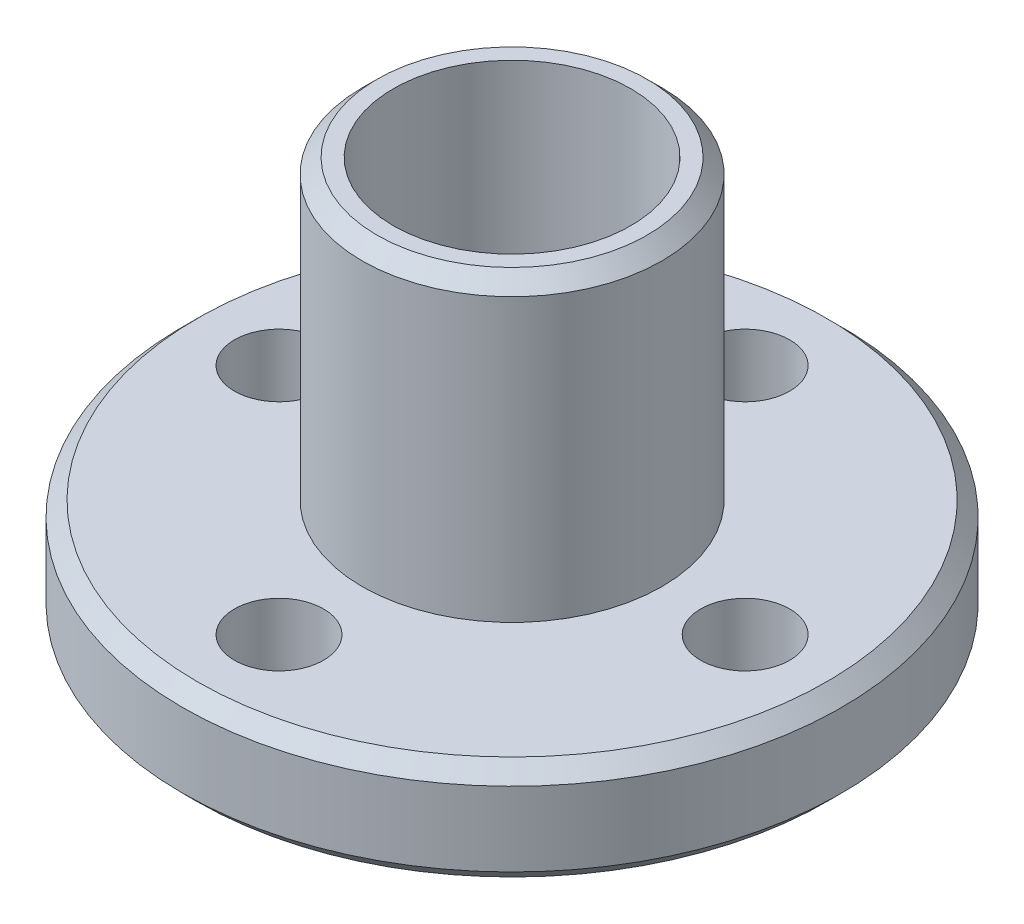
from build123d import *

# Parameters (mm, degrees)
SKETCH1_R           = 11.1
SKETCH1_R_2         = 4
BOSS_EXTRUDE1_DEPTH = 3.5
SKETCH2_R           = 5.05
SKETCH2_R_2         = 4
BOSS_EXTRUDE2_DEPTH = 10
BOSS_EXTRUDE3_START = 1.5
SKETCH3_R           = 5.05
SKETCH3_R_2         = 4
BOSS_EXTRUDE3_DEPTH = 1.5
CUT_EXTRUDE1_REACH  = 22.704
SKETCH4_R           = 1.5
CHAMFER1_SIZE       = 0.5
CHAMFER2_SIZE       = 0.5


with BuildPart() as part:
    # Sketch1 → Boss-Extrude1 (new body)
    with BuildSketch(Plane(origin=(0, 0, 0), x_dir=(1, 0, 0), z_dir=(0, 1, 0))):
        Circle(SKETCH1_R)
        Circle(SKETCH1_R_2, mode=Mode.SUBTRACT)
    extrude(amount=BOSS_EXTRUDE1_DEPTH)

    # Sketch2 → Boss-Extrude2 (add)
    with BuildSketch(Plane(origin=(0, 3.5, 0), x_dir=(1, 0, 0), z_dir=(0, 1, 0))):
        Circle(SKETCH2_R)
        Circle(SKETCH2_R_2, mode=Mode.SUBTRACT)
    extrude(amount=BOSS_EXTRUDE2_DEPTH)

    # Sketch3 → Boss-Extrude3 (add)
    with BuildSketch(Plane.XZ.offset(BOSS_EXTRUDE3_START)):
        Circle(SKETCH3_R)
        Circle(SKETCH3_R_2, mode=Mode.SUBTRACT)
    extrude(amount=-BOSS_EXTRUDE3_DEPTH)

    # Sketch4 → Cut-Extrude1 (cut, up to next)
    with BuildSketch(Plane.XZ, mode=Mode.PRIVATE) as cut_extrude1_sk1:
        with Locations((-7.85, 0)):
            Circle(SKETCH4_R)
    cut_extrude1_tool1 = extrude(cut_extrude1_sk1.sketch, amount=-CUT_EXTRUDE1_REACH, mode=Mode.PRIVATE) & part.part
    # Sketch4 → Cut-Extrude1 (cut, up to next)
    with BuildSketch(Plane.XZ, mode=Mode.PRIVATE) as cut_extrude1_sk2:
        with Locations((0, 7.85)):
            Circle(SKETCH4_R)
    cut_extrude1_tool2 = extrude(cut_extrude1_sk2.sketch, amount=-CUT_EXTRUDE1_REACH, mode=Mode.PRIVATE) & part.part
    # Sketch4 → Cut-Extrude1 (cut, up to next)
    with BuildSketch(Plane.XZ, mode=Mode.PRIVATE) as cut_extrude1_sk3:
        with Locations((7.85, 0)):
            Circle(SKETCH4_R)
    cut_extrude1_tool3 = extrude(cut_extrude1_sk3.sketch, amount=-CUT_EXTRUDE1_REACH, mode=Mode.PRIVATE) & part.part
    # Sketch4 → Cut-Extrude1 (cut, up to next)
    with BuildSketch(Plane.XZ, mode=Mode.PRIVATE) as cut_extrude1_sk4:
        with Locations((0, -7.85)):
            Circle(SKETCH4_R)
    cut_extrude1_tool4 = extrude(cut_extrude1_sk4.sketch, amount=-CUT_EXTRUDE1_REACH, mode=Mode.PRIVATE) & part.part
    add(cut_extrude1_tool1.solids().sort_by_distance((-7.85, 0, 0))[0], mode=Mode.SUBTRACT)
    add(cut_extrude1_tool2.solids().sort_by_distance((0, 0, 7.85))[0], mode=Mode.SUBTRACT)
    add(cut_extrude1_tool3.solids().sort_by_distance((7.85, 0, 0))[0], mode=Mode.SUBTRACT)
    add(cut_extrude1_tool4.solids().sort_by_distance((0, 0, -7.85))[0], mode=Mode.SUBTRACT)

    # Chamfer1
    chamfer1_edges = [part.edges().sort_by_distance(p)[0] for p in [
        (-5.05, 13.5, 0),
        (-11.1, 3.5, 0),
        (-11.1, 0, 0),
        (-5.05, -1.5, 0),
    ]]
    chamfer(chamfer1_edges, length=CHAMFER1_SIZE)

    # Chamfer2
    chamfer2_edges = [part.edges().sort_by_distance(p)[0] for p in [
        (-5.05, 0, 0),
    ]]
    chamfer(chamfer2_edges, length=CHAMFER2_SIZE)


solid = part.part
